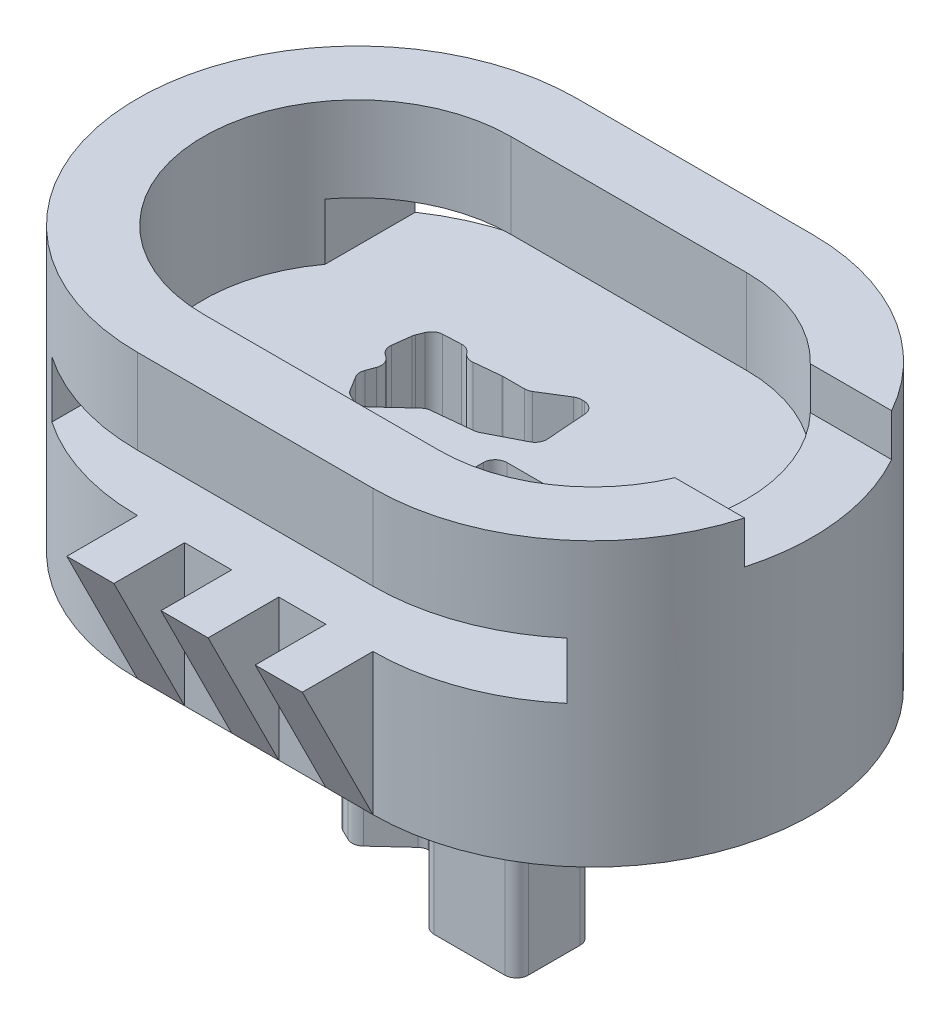
from build123d import *

# Parameters (mm, degrees)
LIP_DEPTH                    = 6
BASE_DEPTH                   = 3
LAMDABREGMAGUIDES_DEPTH      = 5
LAMDABREGMAGUIDES_DEPTH_BACK = 5
SKETCH16_R                   = 0.15
SKETCH16_R_2                 = 0.2
SKETCH3_W                    = 10.638387248
SKETCH3_H                    = 1.2
CUT4ACRYLIC_DEPTH            = 10
SKETCH4_W                    = 2.35
SKETCH4_H                    = 3.533
CUTFORGROUNDPIN_DEPTH        = 0.9
BOSS_EXTRUDE6_DEPTH          = 1
CRVPATTERN1_START            = 3.5
CRVPATTERN1_DEPTH            = 1
CRVPATTERN1_START_2          = 5.5
CRVPATTERN1_2_DEPTH          = 1
BOSS_EXTRUDE7_DEPTH          = 1
CRVPATTERN5_START            = 3.5
CRVPATTERN5_DEPTH            = 1
CRVPATTERN5_START_2          = 5.5
CRVPATTERN5_2_DEPTH          = 1
BOSS_EXTRUDE8_DEPTH          = 0.5
BOSS_EXTRUDE8_DEPTH_BACK     = 5
SKETCH34_W                   = 2.004608144
SKETCH34_H                   = 1.59969208
BOSS_EXTRUDE9_DEPTH          = 5
CUT_EXTRUDE1_DEPTH           = 16.057106113
CUT_EXTRUDE1_DEPTH_BACK      = 16.057106113
CUT_EXTRUDE3_DEPTH           = 10
CUT_EXTRUDE3_DEPTH_BACK      = 10
SKETCH32_W                   = 1.8
SKETCH32_H                   = 1.3
FILLET1_R                    = 0.25


# Read off the part's stored shape, not the designer's step: Lip, CrvPattern1, CrvPattern5
with BuildPart() as part:
    # Lip outline → Lip (new body)
    with BuildSketch(Plane(origin=(0, 0, 0), x_dir=(1, 0, 0), z_dir=(0, 1, 0))):
        with BuildLine():
            ThreePointArc((1.5, 4.6665), (-3.1665, 0), (1.5, -4.6665))
            Line((1.5, -4.6665), (6.5, -4.6665))
            ThreePointArc((6.5, -4.6665), (11.1665, 0), (6.5, 4.6665))
            Line((6.5, 4.6665), (1.5, 4.6665))
        make_face()
        with BuildLine():
            Line((6.5, -3.2665), (1.5, -3.2665))
            ThreePointArc((1.5, -3.2665), (-1.7665, 0), (1.5, 3.2665))
            Line((1.5, 3.2665), (6.5, 3.2665))
            ThreePointArc((6.5, 3.2665), (9.7665, 0), (6.5, -3.2665))
        make_face(mode=Mode.SUBTRACT)
    extrude(amount=LIP_DEPTH)

    # Sketch2 → Base (add)
    with BuildSketch(Plane(origin=(0, 0, 0), x_dir=(1, 0, 0), z_dir=(0, 1, 0))):
        with BuildLine():
            Line((6.5, -3.2665), (1.5, -3.2665))
            ThreePointArc((1.5, -3.2665), (-1.7665, 0), (1.5, 3.2665))
            Line((1.5, 3.2665), (6.5, 3.2665))
            ThreePointArc((6.5, 3.2665), (9.7665, 0), (6.5, -3.2665))
        make_face()
    extrude(amount=BASE_DEPTH)

    # Sketch16 → LamdaBregmaGuides (cut, two sides: drawn at the far end of the back side and taken through both)
    # profile 1 of 3: a face of its own
    with BuildSketch(Plane(origin=(0, 0, 0), x_dir=(1, 0, 0), z_dir=(0, 1, 0)).offset(-LAMDABREGMAGUIDES_DEPTH_BACK)):
        with Locations(Location((8.5, -1, 0), (0, 0, 270))):
            Circle(SKETCH16_R)
    # profile 2 of 3: a face of its own
    with BuildSketch(Plane(origin=(0, 0, 0), x_dir=(1, 0, 0), z_dir=(0, 1, 0)).offset(-LAMDABREGMAGUIDES_DEPTH_BACK)):
        with Locations(Location((6, -2, 0), (0, 0, 270))):
            Circle(SKETCH16_R_2)
    # profile 3 of 3: a face of its own
    with BuildSketch(Plane(origin=(0, 0, 0), x_dir=(1, 0, 0), z_dir=(0, 1, 0)).offset(-LAMDABREGMAGUIDES_DEPTH_BACK)):
        Polygon((0.176095573, -1), (0.088047787, -0.84749676), (-0.088047787, -0.84749676), (-0.176095573, -1), (-0.088047787, -1.15250324), (0.088047787, -1.15250324), align=None)
        with Locations(Location((0, -1, 0), (0, 0, 270))):
            Circle(SKETCH16_R, mode=Mode.SUBTRACT)
    extrude(amount=LAMDABREGMAGUIDES_DEPTH + LAMDABREGMAGUIDES_DEPTH_BACK, mode=Mode.SUBTRACT)


with BuildPart() as lamdabregmaguides_piece_1:
    # of the separate pieces the step leaves, piece 1, a body of its own (lamdabregmaguides_pieces)
    add(part.part.solids().sort_by_distance((6.5, 0, -4.6665))[0])

    # Sketch3 → Cut4Acrylic (cut)
    with BuildSketch(Plane.XY.offset(4.6665)):
        with Locations((4.193105486, 3.6)):
            Rectangle(SKETCH3_W, SKETCH3_H)
    extrude(amount=-CUT4ACRYLIC_DEPTH, mode=Mode.SUBTRACT)

    # Sketch4 → CutforGroundPin (cut)
    with BuildSketch(Plane(origin=(0, 6, 0), x_dir=(1, 0, 0), z_dir=(0, 1, 0))):
        with Locations((10.030760676, 0.5)):
            Rectangle(SKETCH4_W, SKETCH4_H)
    extrude(amount=-CUTFORGROUNDPIN_DEPTH, mode=Mode.SUBTRACT)

    # Sketch21 → Boss-Extrude6 (add)
    with BuildSketch(Plane(origin=(1.5, 0, 0), x_dir=(0, 0, -1), z_dir=(1, 0, 0))):
        Polygon((-4.6665, 3), (-6.1665, 3), (-4.6665, 0), align=None)
    extrude(amount=BOSS_EXTRUDE6_DEPTH)

    # CrvPattern1 outline → CrvPattern1 (add)
    with BuildSketch(Plane.YZ.offset(CRVPATTERN1_START)):
        Polygon((0, 4.6665), (3, 4.6665), (3, 6.1665), align=None)
    extrude(amount=CRVPATTERN1_DEPTH)

    # CrvPattern1 2 outline → CrvPattern1 2 (add)
    with BuildSketch(Plane.YZ.offset(CRVPATTERN1_START_2)):
        Polygon((0, 4.6665), (3, 4.6665), (3, 6.1665), align=None)
    extrude(amount=CRVPATTERN1_2_DEPTH)

    # Sketch22 → Boss-Extrude7 (add)
    with BuildSketch(Plane(origin=(1.5, 0, 0), x_dir=(0, 0, -1), z_dir=(1, 0, 0))):
        Polygon((4.6665, 0), (4.6665, 3), (6.1665, 3), align=None)
    extrude(amount=BOSS_EXTRUDE7_DEPTH)

    # CrvPattern5 outline → CrvPattern5 (add)
    with BuildSketch(Plane.YZ.offset(CRVPATTERN5_START)):
        Polygon((0, -4.6665), (3, -6.1665), (3, -4.6665), align=None)
    extrude(amount=CRVPATTERN5_DEPTH)

    # CrvPattern5 2 outline → CrvPattern5 2 (add)
    with BuildSketch(Plane.YZ.offset(CRVPATTERN5_START_2)):
        Polygon((0, -4.6665), (3, -6.1665), (3, -4.6665), align=None)
    extrude(amount=CRVPATTERN5_2_DEPTH)

    # Sketch34 → Boss-Extrude8 (add, two sides: drawn at the far end of the back side and taken through both)
    with BuildSketch(Plane(origin=(0, 0, 0), x_dir=(1, 0, 0), z_dir=(0, 1, 0)).offset(-BOSS_EXTRUDE8_DEPTH_BACK)):
        with Locations((5.1, -0.42)):
            Rectangle(SKETCH34_W, SKETCH34_H)
    extrude(amount=BOSS_EXTRUDE8_DEPTH + BOSS_EXTRUDE8_DEPTH_BACK)

    # Sketch36 → Boss-Extrude9 (add)
    with BuildSketch(Plane(origin=(0, 0, 0), x_dir=(-1, 0, 0), z_dir=(0, -1, 0))):
        Polygon((-1.981043585, 2.042444066), (-1.188700431, 2.006428468), (-1.022968968, 1.61122267), (-0.942337029, 0.966167161), (-1.25374802, 0.730249744), (-1.075687083, 0.299154844), (-1.416217307, -0.252738967), (-1.851184586, -0.463632193), (-2.6419687, 0.264721596), (-3.594629911, 0.362934092), (-4.58544349, 0.869349921), (-4.481834345, 2.296853703), (-3.98734241, 2.310982044), (-3.32576156, 1.9), (-2.814014925, 1.9), (-2.168339777, 1.835432485), align=None)
    extrude(amount=BOSS_EXTRUDE9_DEPTH)

    # Sketch31 → Cut-Extrude1 (cut, two sides: drawn at the far end of the back side and taken through both)
    with BuildSketch(Plane(origin=(0, 3, 0), x_dir=(1, 0, 0), z_dir=(0, 1, 0)).offset(-CUT_EXTRUDE1_DEPTH_BACK)):
        Polygon((1.831765382, -0.331969349), (2.594330725, 0.370393466), (3.562885826, 0.470244508), (4.460112717, 0.928827141), (4.369983566, 2.170606548), (4.014324084, 2.180768248), (3.35404923, 1.770597505), (2.81404923, 1.770597505), (2.114263926, 1.700618975), (1.908057574, 1.929012942), (1.248057574, 1.899012942), (1.118618993, 1.576661716), (1.048618993, 1.016661716), (1.378618993, 0.766661716), (1.204307806, 0.300181554), (1.494307806, -0.169818446), align=None)
    extrude(amount=CUT_EXTRUDE1_DEPTH + CUT_EXTRUDE1_DEPTH_BACK, mode=Mode.SUBTRACT)

    # Sketch32 → Cut-Extrude3 (cut, two sides: drawn at the far end of the back side and taken through both)
    with BuildSketch(Plane(origin=(0, 0, 0), x_dir=(1, 0, 0), z_dir=(0, 1, 0)).offset(-CUT_EXTRUDE3_DEPTH_BACK)):
        with Locations((5.097695928, -0.42015396)):
            Rectangle(SKETCH32_W, SKETCH32_H)
    extrude(amount=CUT_EXTRUDE3_DEPTH + CUT_EXTRUDE3_DEPTH_BACK, mode=Mode.SUBTRACT)

    # Fillet1
    fillet1_edges = [lamdabregmaguides_piece_1.edges().sort_by_distance(p)[0] for p in [
        (6.102304072, -2.5, -0.37984604),
        (6.102304072, -2.5, 1.21984604),
        (4.097695928, -2.5, 1.21984604),
        (4.097695928, -2.5, -0.37984604),
        (0.942337029, -2.5, -0.966167161),
        (1.022968968, -2.5, -1.61122267),
        (1.188700431, -2.5, -2.006428468),
        (1.981043585, -2.5, -2.042444066),
        (2.168339777, -2.5, -1.835432485),
        (2.814014925, -2.5, -1.9),
        (3.32576156, -2.5, -1.9),
        (3.98734241, -2.5, -2.310982044),
        (4.481834345, -2.5, -2.296853703),
        (4.58544349, -2.5, -0.869349921),
        (3.594629911, -2.5, -0.362934092),
        (2.6419687, -2.5, -0.264721596),
        (1.851184586, -2.5, 0.463632193),
        (1.416217307, -2.5, 0.252738967),
        (1.075687083, -2.5, -0.299154844),
        (1.25374802, -2.5, -0.730249744),
        (1.831765382, -1, 0.331969349),
        (1.494307806, -1, 0.169818446),
        (1.204307806, -1, -0.300181554),
        (1.378618993, -1, -0.766661716),
        (1.048618993, -1, -1.016661716),
        (1.118618993, -1, -1.576661716),
        (1.248057574, -1, -1.899012942),
        (1.908057574, -1, -1.929012942),
        (2.114263926, -1, -1.700618975),
        (2.81404923, -1, -1.770597505),
        (3.35404923, -1, -1.770597505),
        (4.014324084, -1, -2.180768248),
        (4.369983566, -1, -2.170606548),
        (4.460112717, -1, -0.928827141),
        (3.562885826, -1, -0.470244508),
        (2.594330725, -1, -0.370393466),
        (5.997695928, -1, 1.07015396),
        (5.997695928, -1, -0.22984604),
        (4.197695928, -1, -0.22984604),
        (4.197695928, -1, 1.07015396),
    ]]
    fillet(fillet1_edges, radius=FILLET1_R)


with BuildPart() as lamdabregmaguides_piece_2:
    # of the separate pieces the step leaves, piece 2, a body of its own (lamdabregmaguides_pieces)
    add(part.part.solids().sort_by_distance((0, 0, 1.15))[0])


solid = Compound([lamdabregmaguides_piece_1.part, lamdabregmaguides_piece_2.part])
